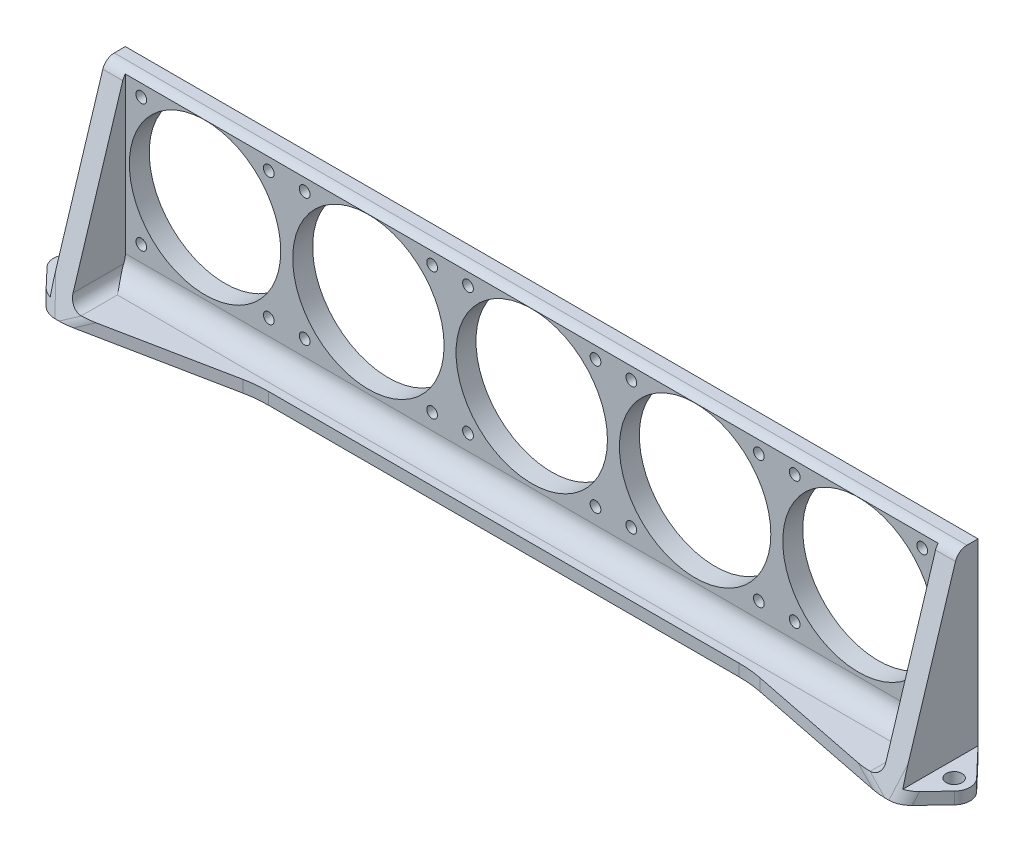
from build123d import *

# Parameters (mm, degrees)
SKETCH1_W               = 204
SKETCH1_H               = 40
BOSS_EXTRUDE1_DEPTH     = 5
SKETCH3_R               = 1.3500000000000054
SKETCH3_R_2             = 19.000000000000004
SKETCH3_R_3             = 1.349999999999999
SKETCH3_R_4             = 1.3499999999999983
SKETCH3_R_5             = 19
SKETCH3_R_6             = 1.3500000000000005
SKETCH3_R_7             = 1.3500000000000059
SKETCH3_R_8             = 1.3499999999999912
CUT_EXTRUDE1_DEPTH      = 105.06248123122955
BOSS_EXTRUDE2_DEPTH     = 3
BOSS_EXTRUDE3_DEPTH     = 5
SKETCH7_R               = 1.9999999999999962
BOSS_EXTRUDE4_DEPTH     = 3
CUT_EXTRUDE2_DEPTH      = 225.65084019428903
CUT_EXTRUDE2_DEPTH_BACK = 225.65084019428903
FILLET1_R               = 30
FILLET3_R               = 5
FILLET4_START           = 5.417424205
FILLET4_DEPTH           = 12.00765993
FILLET4_START_2         = 17.425084135
FILLET4_2_DEPTH         = 1.637415965
FILLET4_START_3         = -108
FILLET4_3_DEPTH         = 216


with BuildPart() as part:
    # Sketch1 → Boss-Extrude1 (new body)
    with BuildSketch(Plane.XY):
        Rectangle(SKETCH1_W, SKETCH1_H)
    extrude(amount=BOSS_EXTRUDE1_DEPTH)

    # Sketch3 → Cut-Extrude1 (cut, through all)
    with BuildSketch(Plane.XY.offset(5)):
        with Locations((-97.99999999999997, 15.999999999999996)):
            Circle(SKETCH3_R)
        with Locations((-66, 16.000000000000004)):
            Circle(SKETCH3_R)
        with Locations((-66, -15.999999999999977)):
            Circle(SKETCH3_R)
        with Locations((-97.99999999999997, -16.000000000000004)):
            Circle(SKETCH3_R)
        with Locations((-81.99999999999997, -3.47e-15)):
            Circle(SKETCH3_R_2)
        with Locations((-56.99999999999997, 15.999999999999996)):
            Circle(SKETCH3_R_3)
        with Locations((-25, 16.000000000000004)):
            Circle(SKETCH3_R_3)
        with Locations((-25, -15.999999999999977)):
            Circle(SKETCH3_R_4)
        with Locations((-56.99999999999997, -16.000000000000004)):
            Circle(SKETCH3_R_4)
        with Locations((-40.99999999999997, -3.47e-15)):
            Circle(SKETCH3_R_5)
        with Locations((-15.999999999999973, 15.999999999999996)):
            Circle(SKETCH3_R_3)
        with Locations((16, 16.000000000000004)):
            Circle(SKETCH3_R_3)
        with Locations((16, -15.999999999999977)):
            Circle(SKETCH3_R_4)
        with Locations((-15.999999999999973, -16.000000000000004)):
            Circle(SKETCH3_R_6)
        Circle(SKETCH3_R_2)
        with Locations((25.00000000000002, 15.999999999999996)):
            Circle(SKETCH3_R)
        with Locations((56.99999999999999, 16.000000000000004)):
            Circle(SKETCH3_R_3)
        with Locations((56.99999999999999, -15.999999999999977)):
            Circle(SKETCH3_R)
        with Locations((25.00000000000002, -16.000000000000004)):
            Circle(SKETCH3_R_7)
        with Locations((41.00000000000002, -3.47e-15)):
            Circle(SKETCH3_R_2)
        with Locations((66.00000000000003, 15.999999999999996)):
            Circle(SKETCH3_R)
        with Locations((98, 16.000000000000004)):
            Circle(SKETCH3_R_8)
        with Locations((98, -15.999999999999977)):
            Circle(SKETCH3_R)
        with Locations((66.00000000000003, -16.000000000000004)):
            Circle(SKETCH3_R)
        with Locations((82.00000000000003, -3.47e-15)):
            Circle(SKETCH3_R_2)
    extrude(amount=-CUT_EXTRUDE1_DEPTH, mode=Mode.SUBTRACT)

    # Sketch5 → Boss-Extrude2 (add)
    with BuildSketch(Plane.XY.offset(5)):
        Polygon((-101.99999999999999, -20), (102.00000000000001, -20), (102.00000000000001, -28), (-101.99999999999999, -27.999999999999996), align=None)
    extrude(amount=-BOSS_EXTRUDE2_DEPTH)

    # Sketch6 → Boss-Extrude3 (add)
    with BuildSketch(Plane.ZY.offset(101.99999999999999)):
        Polygon((0, 20), (5, 20), (20, -27.999999999999996), (0, -28), align=None)
    boss_extrude3 = extrude(amount=BOSS_EXTRUDE3_DEPTH)

    # Sketch7 → Boss-Extrude4 (add)
    # profile 1 of 2: a face of its own
    with BuildSketch(Plane.XZ.offset(27.999999999999996)):
        with BuildLine():
            ThreePointArc((-113.89655172413792, 7.241379310344828), (-114.99999999999999, 10.000000000000002), (-113.89655172413792, 12.758620689655173))
            Line((-113.89655172413792, 12.758620689655173), (-106.99999999999999, 20))
            Line((-106.99999999999999, 20), (-106.99999999999999, 0))
            Line((-106.99999999999999, 0), (-113.89655172413792, 7.241379310344828))
        make_face()
        with Locations(Location((-110.99999999999999, 10, 0), (0, 0, 270))):
            Circle(SKETCH7_R, mode=Mode.SUBTRACT)
    # profile 2 of 2: a face of its own
    with BuildSketch(Plane.XZ.offset(27.999999999999996)):
        Polygon((-61.99999999999998, 12.000000000000012), (-101.99999999999999, 20), (-101.99999999999999, 5), (0, 5.0000000000000195), (-8.6e-16, 12.00000000000001), align=None)
    boss_extrude4 = extrude(amount=-BOSS_EXTRUDE4_DEPTH)

    # Mirror1: Boss-Extrude3, Boss-Extrude4 across plane
    add(boss_extrude3.mirror(Plane(origin=(0, 0, 0), x_dir=(0, 0, 1), z_dir=(1, 0, 0))))
    add(boss_extrude4.mirror(Plane(origin=(0, 0, 0), x_dir=(0, 0, 1), z_dir=(1, 0, 0))))

    # Sketch8 → Cut-Extrude2 (cut, two sides: drawn at the far end of the back side and taken through both)
    with BuildSketch(Plane(origin=(-106.99999999999999, 0, 0), x_dir=(0, 0, -1), z_dir=(1, 0, 0)).offset(-CUT_EXTRUDE2_DEPTH_BACK)):
        Polygon((-20, -27.999999999999996), (-18.47924649389312, -23.133588780457977), (-22.698909266978262, -25.783585861034908), align=None)
    extrude(amount=CUT_EXTRUDE2_DEPTH + CUT_EXTRUDE2_DEPTH_BACK, mode=Mode.SUBTRACT)

    # Fillet1
    fillet1_edges = [part.edges().sort_by_distance(p)[0] for p in [
        (-61.99999999999998, -26.499999999999996, 12.000000000000012),
        (61.99999999999998, -26.499999999999996, 12.000000000000012),
    ]]
    fillet(fillet1_edges, radius=FILLET1_R)

    # Fillet3
    fillet3_edges = [part.edges().sort_by_distance(p)[0] for p in [
        (0, -24.999999999999996, 5),
        (99.65624999999999, -26.499999999999993, 19.53125),
        (-99.65624999999999, -26.499999999999996, 19.53125),
        (-107.44642857142854, -26.499999999999996, 19.53125),
        (107.44642857142858, -26.499999999999996, 19.531250000000004),
    ]]
    fillet(fillet3_edges, radius=FILLET3_R)

    # Fillet4: read off the stored shape, not the designer's step
    # Fillet4 outline → Fillet4 (add)
    with BuildSketch(Plane.XY.offset(FILLET4_START)):
        with BuildLine():
            ThreePointArc((-99, -25), (-101.121320344, -24.121320344), (-102, -22))
            Line((-102, -22), (-102, -25))
            Line((-102, -25), (-99, -25))
        make_face()
        with BuildLine():
            ThreePointArc((102, -22), (101.121320344, -24.121320344), (99, -25))
            Line((99, -25), (102, -25))
            Line((102, -25), (102, -22))
        make_face()
    extrude(amount=FILLET4_DEPTH)

    # Fillet4 2 outline → Fillet4 2 (add)
    with BuildSketch(Plane.XY.offset(FILLET4_START_2)):
        with BuildLine():
            ThreePointArc((-99, -25), (-101.121320344, -24.121320344), (-102, -22))
            Line((-102, -22), (-102, -25))
            Line((-102, -25), (-99, -25))
        make_face()
        with BuildLine():
            ThreePointArc((102, -22), (101.121320344, -24.121320344), (99, -25))
            Line((99, -25), (102, -25))
            Line((102, -25), (102, -22))
        make_face()
    extrude(amount=FILLET4_2_DEPTH)

    # Fillet4 3 outline → Fillet4 3 (cut)
    with BuildSketch(Plane.YZ.offset(FILLET4_START_3)):
        with BuildLine():
            ThreePointArc((17.894824979, 5.657867194), (19.417072086, 4.571436695), (20, 2.79442726))
            Line((20, 2.79442726), (20, 21))
            Line((20, 21), (-27, 21))
            Line((-27, 21), (-27, 19.687500007))
            Line((-27, 19.687500007), (-25.000000027, 19.062500015))
            Line((-25.000000027, 19.062500015), (17.894824979, 5.657867194))
        make_face()
    extrude(amount=FILLET4_3_DEPTH, mode=Mode.SUBTRACT)


solid = part.part
